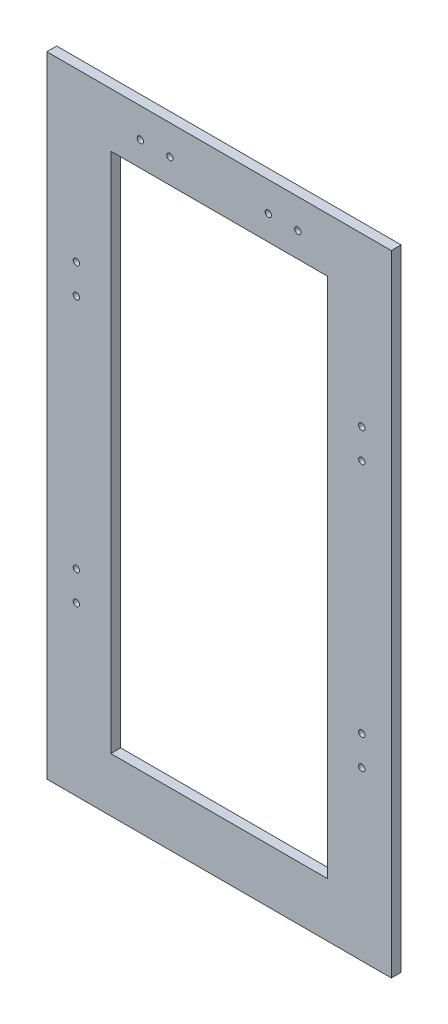
from build123d import *

# Parameters (mm, degrees)
SKETCH1_W           = 175
SKETCH1_H           = 320
BOSS_EXTRUDE1_DEPTH = 5
CUT_EXTRUDE1_REACH  = 184.431
SKETCH2_W           = 110
SKETCH2_H           = 265
CUT_EXTRUDE2_REACH  = 184.431
SKETCH4_R           = 1.6
CUT_EXTRUDE3_REACH  = 184.431
SKETCH5_R           = 1.6


with BuildPart() as part:
    # Sketch1 → Boss-Extrude1 (new body)
    with BuildSketch(Plane.XY):
        Rectangle(SKETCH1_W, SKETCH1_H)
    extrude(amount=BOSS_EXTRUDE1_DEPTH)

    # Sketch2 → Cut-Extrude1 (cut, up to next)
    with BuildSketch(Plane(origin=(0, 0, 0), x_dir=(-1, 0, 0), z_dir=(0, 0, -1)), mode=Mode.PRIVATE) as cut_extrude1_sk1:
        Rectangle(SKETCH2_W, SKETCH2_H)
    cut_extrude1_tool1 = extrude(cut_extrude1_sk1.sketch, amount=-CUT_EXTRUDE1_REACH, mode=Mode.PRIVATE) & part.part
    add(cut_extrude1_tool1.solids().sort_by_distance((0, 0, 0))[0], mode=Mode.SUBTRACT)

    # Sketch4 → Cut-Extrude2 (cut, up to next)
    with BuildSketch(Plane(origin=(0, 0, 0), x_dir=(-1, 0, 0), z_dir=(0, 0, -1)), mode=Mode.PRIVATE) as cut_extrude2_sk1:
        with Locations((-25, 145)):
            Circle(SKETCH4_R)
    cut_extrude2_tool1 = extrude(cut_extrude2_sk1.sketch, amount=-CUT_EXTRUDE2_REACH, mode=Mode.PRIVATE) & part.part
    # Sketch4 → Cut-Extrude2 (cut, up to next)
    with BuildSketch(Plane(origin=(0, 0, 0), x_dir=(-1, 0, 0), z_dir=(0, 0, -1)), mode=Mode.PRIVATE) as cut_extrude2_sk2:
        with Locations((-40, 145)):
            Circle(SKETCH4_R)
    cut_extrude2_tool2 = extrude(cut_extrude2_sk2.sketch, amount=-CUT_EXTRUDE2_REACH, mode=Mode.PRIVATE) & part.part
    # Sketch4 → Cut-Extrude2 (cut, up to next)
    with BuildSketch(Plane(origin=(0, 0, 0), x_dir=(-1, 0, 0), z_dir=(0, 0, -1)), mode=Mode.PRIVATE) as cut_extrude2_sk3:
        with Locations((25, 145)):
            Circle(SKETCH4_R)
    cut_extrude2_tool3 = extrude(cut_extrude2_sk3.sketch, amount=-CUT_EXTRUDE2_REACH, mode=Mode.PRIVATE) & part.part
    # Sketch4 → Cut-Extrude2 (cut, up to next)
    with BuildSketch(Plane(origin=(0, 0, 0), x_dir=(-1, 0, 0), z_dir=(0, 0, -1)), mode=Mode.PRIVATE) as cut_extrude2_sk4:
        with Locations((40, 145)):
            Circle(SKETCH4_R)
    cut_extrude2_tool4 = extrude(cut_extrude2_sk4.sketch, amount=-CUT_EXTRUDE2_REACH, mode=Mode.PRIVATE) & part.part
    add(cut_extrude2_tool1.solids().sort_by_distance((25, 145, 0))[0], mode=Mode.SUBTRACT)
    add(cut_extrude2_tool2.solids().sort_by_distance((40, 145, 0))[0], mode=Mode.SUBTRACT)
    add(cut_extrude2_tool3.solids().sort_by_distance((-25, 145, 0))[0], mode=Mode.SUBTRACT)
    add(cut_extrude2_tool4.solids().sort_by_distance((-40, 145, 0))[0], mode=Mode.SUBTRACT)

    # Sketch5 → Cut-Extrude3 (cut, up to next)
    with BuildSketch(Plane(origin=(0, 0, 0), x_dir=(-1, 0, 0), z_dir=(0, 0, -1)), mode=Mode.PRIVATE) as cut_extrude3_sk1:
        with Locations((-72.5, 75)):
            Circle(SKETCH5_R)
    cut_extrude3_tool1 = extrude(cut_extrude3_sk1.sketch, amount=-CUT_EXTRUDE3_REACH, mode=Mode.PRIVATE) & part.part
    # Sketch5 → Cut-Extrude3 (cut, up to next)
    with BuildSketch(Plane(origin=(0, 0, 0), x_dir=(-1, 0, 0), z_dir=(0, 0, -1)), mode=Mode.PRIVATE) as cut_extrude3_sk2:
        with Locations((-72.5, 60)):
            Circle(SKETCH5_R)
    cut_extrude3_tool2 = extrude(cut_extrude3_sk2.sketch, amount=-CUT_EXTRUDE3_REACH, mode=Mode.PRIVATE) & part.part
    # Sketch5 → Cut-Extrude3 (cut, up to next)
    with BuildSketch(Plane(origin=(0, 0, 0), x_dir=(-1, 0, 0), z_dir=(0, 0, -1)), mode=Mode.PRIVATE) as cut_extrude3_sk3:
        with Locations((-72.5, -75)):
            Circle(SKETCH5_R)
    cut_extrude3_tool3 = extrude(cut_extrude3_sk3.sketch, amount=-CUT_EXTRUDE3_REACH, mode=Mode.PRIVATE) & part.part
    # Sketch5 → Cut-Extrude3 (cut, up to next)
    with BuildSketch(Plane(origin=(0, 0, 0), x_dir=(-1, 0, 0), z_dir=(0, 0, -1)), mode=Mode.PRIVATE) as cut_extrude3_sk4:
        with Locations((-72.5, -60)):
            Circle(SKETCH5_R)
    cut_extrude3_tool4 = extrude(cut_extrude3_sk4.sketch, amount=-CUT_EXTRUDE3_REACH, mode=Mode.PRIVATE) & part.part
    # Sketch5 → Cut-Extrude3 (cut, up to next)
    with BuildSketch(Plane(origin=(0, 0, 0), x_dir=(-1, 0, 0), z_dir=(0, 0, -1)), mode=Mode.PRIVATE) as cut_extrude3_sk5:
        with Locations((72.5, -75)):
            Circle(SKETCH5_R)
    cut_extrude3_tool5 = extrude(cut_extrude3_sk5.sketch, amount=-CUT_EXTRUDE3_REACH, mode=Mode.PRIVATE) & part.part
    # Sketch5 → Cut-Extrude3 (cut, up to next)
    with BuildSketch(Plane(origin=(0, 0, 0), x_dir=(-1, 0, 0), z_dir=(0, 0, -1)), mode=Mode.PRIVATE) as cut_extrude3_sk6:
        with Locations((72.5, -60)):
            Circle(SKETCH5_R)
    cut_extrude3_tool6 = extrude(cut_extrude3_sk6.sketch, amount=-CUT_EXTRUDE3_REACH, mode=Mode.PRIVATE) & part.part
    # Sketch5 → Cut-Extrude3 (cut, up to next)
    with BuildSketch(Plane(origin=(0, 0, 0), x_dir=(-1, 0, 0), z_dir=(0, 0, -1)), mode=Mode.PRIVATE) as cut_extrude3_sk7:
        with Locations((72.5, 60)):
            Circle(SKETCH5_R)
    cut_extrude3_tool7 = extrude(cut_extrude3_sk7.sketch, amount=-CUT_EXTRUDE3_REACH, mode=Mode.PRIVATE) & part.part
    # Sketch5 → Cut-Extrude3 (cut, up to next)
    with BuildSketch(Plane(origin=(0, 0, 0), x_dir=(-1, 0, 0), z_dir=(0, 0, -1)), mode=Mode.PRIVATE) as cut_extrude3_sk8:
        with Locations((72.5, 75)):
            Circle(SKETCH5_R)
    cut_extrude3_tool8 = extrude(cut_extrude3_sk8.sketch, amount=-CUT_EXTRUDE3_REACH, mode=Mode.PRIVATE) & part.part
    add(cut_extrude3_tool1.solids().sort_by_distance((72.5, 75, 0))[0], mode=Mode.SUBTRACT)
    add(cut_extrude3_tool2.solids().sort_by_distance((72.5, 60, 0))[0], mode=Mode.SUBTRACT)
    add(cut_extrude3_tool3.solids().sort_by_distance((72.5, -75, 0))[0], mode=Mode.SUBTRACT)
    add(cut_extrude3_tool4.solids().sort_by_distance((72.5, -60, 0))[0], mode=Mode.SUBTRACT)
    add(cut_extrude3_tool5.solids().sort_by_distance((-72.5, -75, 0))[0], mode=Mode.SUBTRACT)
    add(cut_extrude3_tool6.solids().sort_by_distance((-72.5, -60, 0))[0], mode=Mode.SUBTRACT)
    add(cut_extrude3_tool7.solids().sort_by_distance((-72.5, 60, 0))[0], mode=Mode.SUBTRACT)
    add(cut_extrude3_tool8.solids().sort_by_distance((-72.5, 75, 0))[0], mode=Mode.SUBTRACT)


solid = part.part
